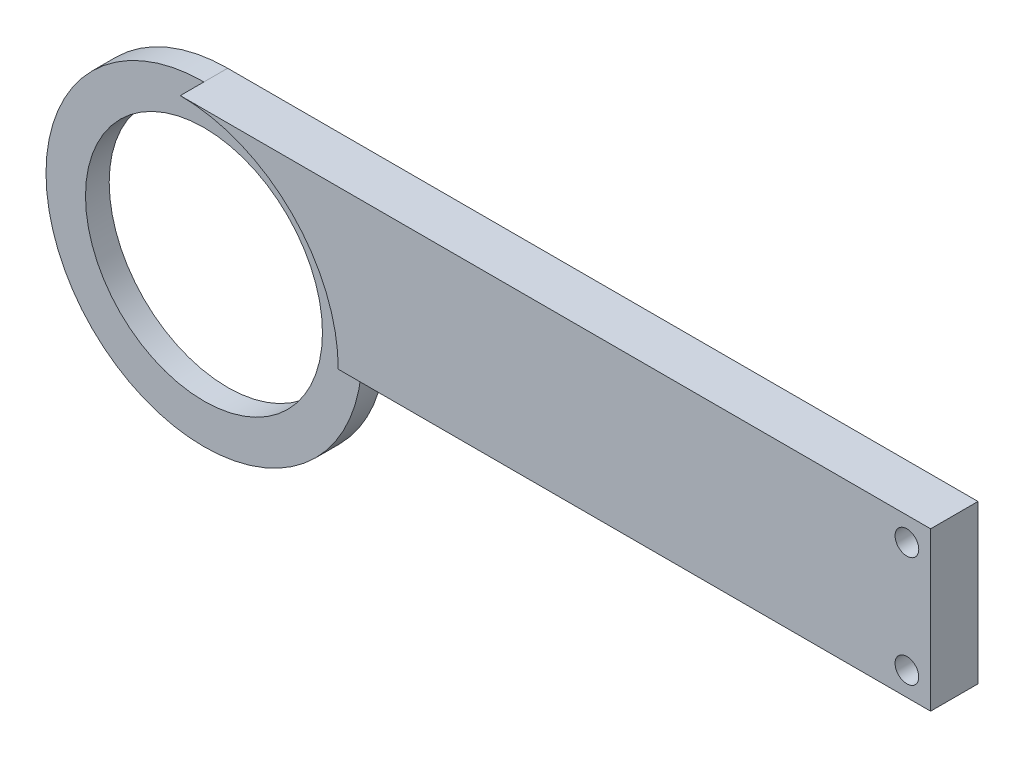
from build123d import *

# Parameters (mm, degrees)
ESQUISSE1_R             = 15
BOSS_EXTRU_1_DEPTH      = 6
ENL_V_START             = -3
ESQUISSE2_R             = 20
ESQUISSE2_R_2           = 15
ENL_V_MAT_EXTRU_1_DEPTH = 3
ESQUISSE3_W             = 9.17
ESQUISSE3_H             = 20
BOSS_EXTRU_2_DEPTH      = 6
ESQUISSE4_R             = 1.5
ENL_V_MAT_EXTRU_2_DEPTH = 10


with BuildPart() as part:
    # Esquisse1 → Boss.-Extru.1 (new body)
    with BuildSketch(Plane.XY):
        with BuildLine():
            Line((42.613906887, 3.786407767), (42.613906887, 23.786407767))
            Line((42.613906887, 23.786407767), (-43.211335831, 23.786407767))
            ThreePointArc((-43.211335831, 23.786407767), (-57.353471455, -10.355727857), (-23.211335831, 3.786407767))
            Line((-23.211335831, 3.786407767), (42.613906887, 3.786407767))
        make_face()
        with Locations((-43.211335831, 3.786407767)):
            Circle(ESQUISSE1_R, mode=Mode.SUBTRACT)
    extrude(amount=BOSS_EXTRU_1_DEPTH)

    # Esquisse2 → Enlèv. mat.-Extru.1 (cut)
    with BuildSketch(Plane.XY.offset(6).offset(ENL_V_START)):
        with Locations((-43.211335831, 3.786407767)):
            Circle(ESQUISSE2_R)
        with Locations((-43.211335831, 3.786407767)):
            Circle(ESQUISSE2_R_2, mode=Mode.SUBTRACT)
    extrude(amount=ENL_V_MAT_EXTRU_1_DEPTH, mode=Mode.SUBTRACT)

    # Esquisse3 → Boss.-Extru.2 (add)
    with BuildSketch(Plane.XY.offset(6)):
        with Locations((47.198906887, 13.786407767)):
            Rectangle(ESQUISSE3_W, ESQUISSE3_H)
    extrude(amount=-BOSS_EXTRU_2_DEPTH)

    # Esquisse4 → Enlèv. mat.-Extru.2 (cut)
    with BuildSketch(Plane(origin=(0, 0, 0), x_dir=(-1, 0, 0), z_dir=(0, 0, -1))):
        with Locations((-48.783906887, 20.786407767)):
            Circle(ESQUISSE4_R)
        with Locations((-48.783906887, 6.786407767)):
            Circle(ESQUISSE4_R)
    extrude(amount=-ENL_V_MAT_EXTRU_2_DEPTH, mode=Mode.SUBTRACT)


solid = part.part
